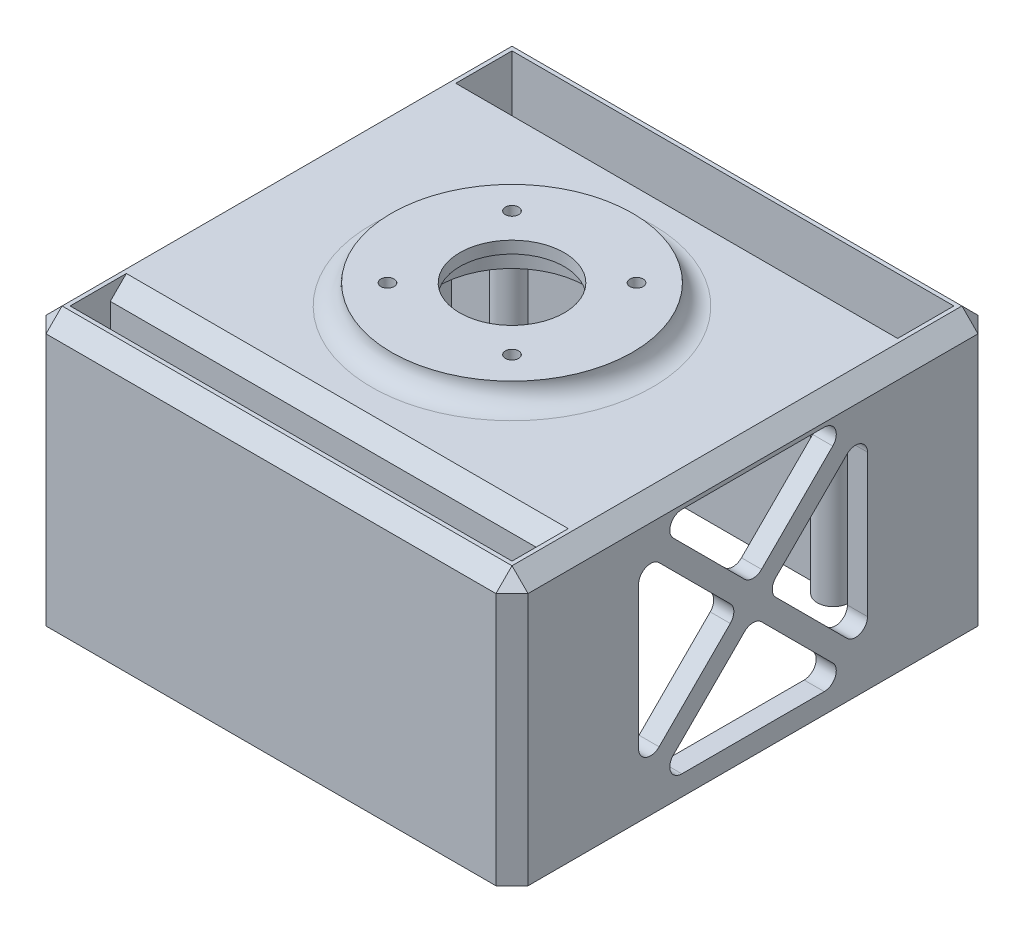
from build123d import *

# Parameters (mm, degrees)
SKETCH_1_W          = 120
SKETCH_1_H          = 120
EXTRUDE_1_DEPTH     = 67
SHELL_1_T           = -5
SKETCH_3_R          = 30
EXTRUDE_2_DEPTH     = 5
SKETCH_2_R          = 1.65
SKETCH_2_R_2        = 18.5
CUT_EXTRUDE_1_DEPTH = 181.676506497
EXTRUDE_START       = -3
SKETCH_4_R          = 18.5
SKETCH_4_R_2        = 13
EXTRUDE_3_DEPTH     = 3
FILLET_2_R          = 5
SKETCH_6_W          = 110
SKETCH_6_H          = 10
CUT_EXTRUDE_2_DEPTH = 5
SKETCH_8_W          = 110
SKETCH_8_H          = 5
EXTRUDE_4_DEPTH     = 57
SKETCH_9_R          = 4
EXTRUDE_5_DEPTH     = 57
SKETCH_10_R         = 1.9
CUT_EXTRUDE_3_DEPTH = 3.5
CUT_EXTRUDE_4_DEPTH = 185.347497949
FILLET_3_R          = 3
CHAMFER_1_SIZE      = 4
CHAMFER_2_SIZE      = 0.5


with BuildPart() as part:
    # 草图1 → 凸台-拉伸1 (new body)
    with BuildSketch(Plane(origin=(0, 0, 0), x_dir=(1, 0, 0), z_dir=(0, 1, 0))):
        with Locations((60, 60)):
            Rectangle(SKETCH_1_W, SKETCH_1_H)
    extrude(amount=EXTRUDE_1_DEPTH)

    # 抽壳1
    shell_1_openings = [part.faces().sort_by_distance(p)[0] for p in [
        (60, 0, -60),
    ]]
    offset(amount=SHELL_1_T, openings=shell_1_openings, kind=Kind.INTERSECTION)

    # 草图3 → 凸台-拉伸2 (add)
    with BuildSketch(Plane(origin=(0, 67, 0), x_dir=(1, 0, 0), z_dir=(0, 1, 0))):
        with Locations(Location((60, 60, 0), (0, 0, 270))):
            Circle(SKETCH_3_R)
    extrude(amount=EXTRUDE_2_DEPTH)

    # 草图2 → 切除-拉伸1 (cut, through all)
    with BuildSketch(Plane.XZ.offset(-62)):
        with Locations(Location((44.5, -44.5, 0), (0, 0, 270))):
            Circle(SKETCH_2_R)
        with Locations(Location((44.5, -75.5, 0), (0, 0, 270))):
            Circle(SKETCH_2_R)
        with Locations(Location((75.5, -44.5, 0), (0, 0, 270))):
            Circle(SKETCH_2_R)
        with Locations(Location((75.5, -75.5, 0), (0, 0, 270))):
            Circle(SKETCH_2_R)
        with Locations(Location((60, -60, 0), (0, 0, 270))):
            Circle(SKETCH_2_R_2)
    extrude(amount=-CUT_EXTRUDE_1_DEPTH, mode=Mode.SUBTRACT)

    # 草图4 → 凸台-拉伸3 (add)
    with BuildSketch(Plane(origin=(0, 72, 0), x_dir=(1, 0, 0), z_dir=(0, 1, 0)).offset(EXTRUDE_START)):
        with Locations(Location((60, 60, 0), (0, 0, 90))):
            Circle(SKETCH_4_R)
        with Locations(Location((60, 60, 0), (0, 0, 270))):
            Circle(SKETCH_4_R_2, mode=Mode.SUBTRACT)
    extrude(amount=EXTRUDE_3_DEPTH)

    # 圆角2
    fillet_2_edges = [part.edges().sort_by_distance(p)[0] for p in [
        (60, 67, -90),
    ]]
    fillet(fillet_2_edges, radius=FILLET_2_R - 0.0001)  # a hair under: the kernel refuses the full size

    # 草图6 → 切除-拉伸2 (cut)
    with BuildSketch(Plane(origin=(0, 67, 0), x_dir=(1, 0, 0), z_dir=(0, 1, 0))):
        with Locations((60, 10)):
            Rectangle(SKETCH_6_W, SKETCH_6_H)
        with Locations((60, 110)):
            Rectangle(SKETCH_6_W, SKETCH_6_H)
    extrude(amount=-CUT_EXTRUDE_2_DEPTH, mode=Mode.SUBTRACT)

    # 草图8 → 凸台-拉伸4 (add)
    with BuildSketch(Plane.XZ.offset(-62)):
        with Locations((60, -17.5)):
            Rectangle(SKETCH_8_W, SKETCH_8_H)
        with Locations((60, -102.5)):
            Rectangle(SKETCH_8_W, SKETCH_8_H)
    extrude(amount=EXTRUDE_4_DEPTH)

    # 草图9 → 凸台-拉伸5 (add)
    with BuildSketch(Plane.XZ.offset(-62)):
        with Locations((20, -20)):
            Circle(SKETCH_9_R)
        with Locations((20, -100)):
            Circle(SKETCH_9_R)
        with Locations((100, -100)):
            Circle(SKETCH_9_R)
        with Locations((100, -20)):
            Circle(SKETCH_9_R)
    extrude(amount=EXTRUDE_5_DEPTH)

    # 草图10 → 切除-拉伸3 (cut)
    with BuildSketch(Plane.XZ.offset(-5)):
        with Locations(Location((20, -100, 0), (0, 0, 270))):
            Circle(SKETCH_10_R)
        with Locations(Location((100, -100, 0), (0, 0, 270))):
            Circle(SKETCH_10_R)
        with Locations(Location((100, -20, 0), (0, 0, 270))):
            Circle(SKETCH_10_R)
        with Locations(Location((20, -20, 0), (0, 0, 270))):
            Circle(SKETCH_10_R)
    extrude(amount=-CUT_EXTRUDE_3_DEPTH, mode=Mode.SUBTRACT)

    # 草图12 → 切除-拉伸4 (cut, through all)
    with BuildSketch(Plane(origin=(120, 0, 0), x_dir=(0, 0, -1), z_dir=(1, 0, 0))):
        Polygon((31.5, 58.464466094), (56.464466094, 33.5), (31.5, 8.535533906), align=None)
        Polygon((35.035533906, 62), (84.964466094, 62), (60, 37.035533906), align=None)
        Polygon((88.5, 58.464466094), (88.5, 8.535533906), (63.535533906, 33.5), align=None)
        Polygon((84.964466094, 5), (35.035533906, 5), (60, 29.964466094), align=None)
    extrude(amount=-CUT_EXTRUDE_4_DEPTH, mode=Mode.SUBTRACT)

    # 圆角3
    fillet_3_edges = [part.edges().sort_by_distance(p)[0] for p in [
        (2.5, 33.5, -63.535533906),
        (2.5, 58.464466094, -88.5),
        (2.5, 8.535533906, -88.5),
        (117.5, 33.5, -63.535533906),
        (117.5, 58.464466094, -88.5),
        (117.5, 8.535533906, -88.5),
        (2.5, 37.035533906, -60),
        (2.5, 62, -84.964466094),
        (2.5, 62, -35.035533906),
        (117.5, 62, -35.035533906),
        (117.5, 37.035533906, -60),
        (117.5, 62, -84.964466094),
        (2.5, 29.964466094, -60),
        (2.5, 5, -84.964466094),
        (2.5, 5, -35.035533906),
        (117.5, 29.964466094, -60),
        (117.5, 5, -84.964466094),
        (117.5, 5, -35.035533906),
        (2.5, 8.535533906, -31.5),
        (2.5, 58.464466094, -31.5),
        (2.5, 33.5, -56.464466094),
        (117.5, 8.535533906, -31.5),
        (117.5, 58.464466094, -31.5),
        (117.5, 33.5, -56.464466094),
    ]]
    fillet(fillet_3_edges, radius=FILLET_3_R)

    # 倒角1
    chamfer_1_edges = [part.edges().sort_by_distance(p)[0] for p in [
        (120, 67, -60),
        (60, 67, -120),
        (0, 67, -60),
        (60, 67, -15),
        (60, 67, -105),
        (0, 33.5, -120),
        (120, 33.5, -120),
        (120, 33.5, 0),
        (0, 33.5, 0),
        (60, 67, 0),
    ]]
    chamfer(chamfer_1_edges, length=CHAMFER_1_SIZE)

    # 倒角2
    chamfer_2_edges = [part.edges().sort_by_distance(p)[0] for p in [
        (20, 5, -18.1),
        (100, 5, -18.1),
        (100, 5, -98.1),
        (20, 5, -98.1),
    ]]
    chamfer(chamfer_2_edges, length=CHAMFER_2_SIZE)


solid = part.part
